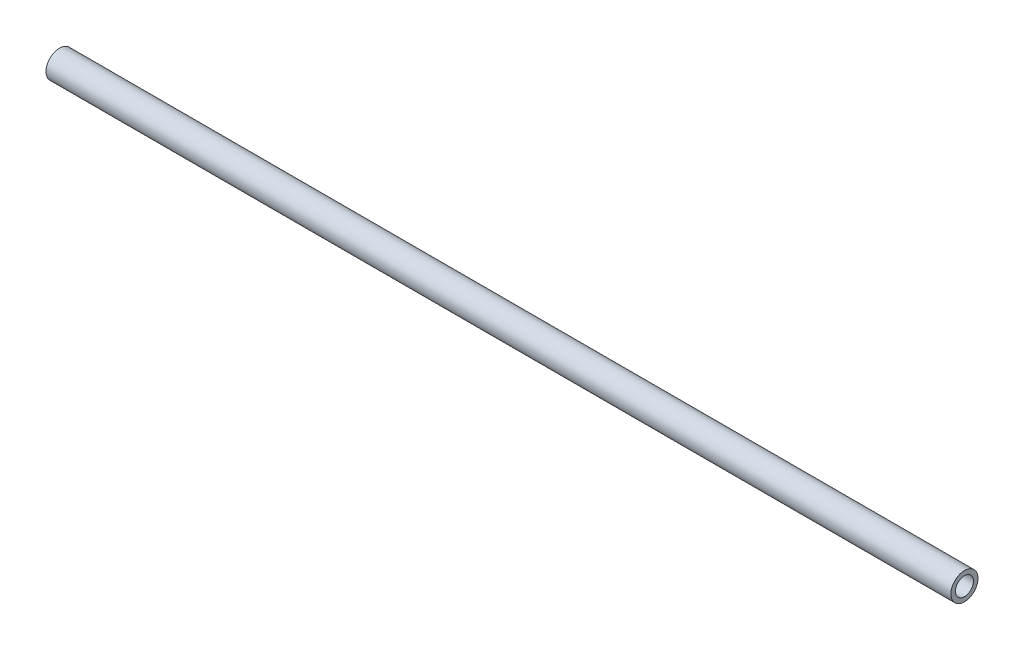
from build123d import *

# Parameters (mm, degrees)
SKETCH1_R           = 9.525
SKETCH1_R_2         = 6.35
BOSS_EXTRUDE1_DEPTH = 635


with BuildPart() as part:
    # Sketch1 → Boss-Extrude1 (new body)
    with BuildSketch(Plane(origin=(0, 0, 0), x_dir=(0, 0, -1), z_dir=(1, 0, 0))):
        Circle(SKETCH1_R)
        Circle(SKETCH1_R_2, mode=Mode.SUBTRACT)
    extrude(amount=BOSS_EXTRUDE1_DEPTH)


solid = part.part
